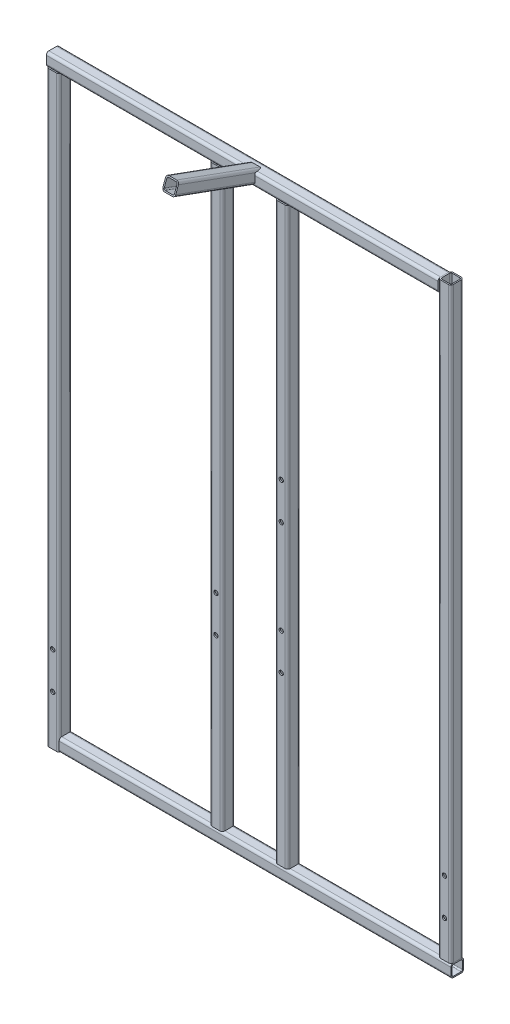
from build123d import *

# Parameters (mm, degrees)
SQUARE_START                          = -467.2
SQUARE_TUBE_20_X_20_X_2_1_DEPTH       = 914.4
SQUARE_START_2                        = -294.8
SQUARE_TUBE_20_X_20_X_2_1_2_DEPTH     = 609.6
SQUARE_START_3                        = -314.8
SQUARE_TUBE_20_X_20_X_2_1_3_DEPTH     = 609.6
SQUARE_START_4                        = -447.2
SQUARE_TUBE_20_X_20_X_2_1_4_DEPTH     = 914.4
SQUARE_TUBE_20_X_20_X_2_1_5_DEPTH     = 894.4
SQUARE_TUBE_20_X_20_X_2_1_6_DEPTH     = 894.4
SQUARE_START_5                        = 158.134879336
SQUARE_TUBE_20_X_20_X_2_1_7_DEPTH     = 137.936730192
SQUARE_START_6                        = 447
SQUARE_TUBE_20_X_20_X_2_1_8_OUTLINE_W = 24
SQUARE_TUBE_20_X_20_X_2_1_8_OUTLINE_H = 13
SQUARE_TUBE_20_X_20_X_2_1_8_DEPTH     = 20.2
SKETCH12_R                            = 3.3782
CUT_EXTRUDE2_DEPTH                    = 616.817984795
SKETCH13_R                            = 3.3782
CUT_EXTRUDE3_DEPTH                    = 616.817984795
SKETCH14_R                            = 3.3782
CUT_EXTRUDE4_DEPTH                    = 616.817984795


with BuildPart() as part:
    # Square tube 20 X 20 X 2(1): read off the stored shape, not the designer's step
    # Square tube 20 X 20 X 2(1) outline → Square tube 20 X 20 X 2(1) (new body)
    with BuildSketch(Plane(origin=(0, 0, 0), x_dir=(1, 0, 0), z_dir=(0, 1, 0)).offset(SQUARE_START)):
        with BuildLine():
            Line((-314.8, 6), (-314.8, -6))
            ThreePointArc((-314.8, -6), (-313.628427125, -8.828427125), (-310.8, -10))
            Line((-310.8, -10), (-298.8, -10))
            ThreePointArc((-298.8, -10), (-295.971572875, -8.828427125), (-294.8, -6))
            Line((-294.8, -6), (-294.8, 6))
            ThreePointArc((-294.8, 6), (-295.971572875, 8.828427125), (-298.8, 10))
            Line((-298.8, 10), (-310.8, 10))
            ThreePointArc((-310.8, 10), (-313.628427125, 8.828427125), (-314.8, 6))
        make_face()
        with BuildLine():
            ThreePointArc((-298.8, 8), (-297.385786438, 7.414213562), (-296.8, 6))
            Line((-296.8, 6), (-296.8, -6))
            ThreePointArc((-296.8, -6), (-297.385786438, -7.414213562), (-298.8, -8))
            Line((-298.8, -8), (-310.8, -8))
            ThreePointArc((-310.8, -8), (-312.214213562, -7.414213562), (-312.8, -6))
            Line((-312.8, -6), (-312.8, 6))
            ThreePointArc((-312.8, 6), (-312.214213562, 7.414213562), (-310.8, 8))
            Line((-310.8, 8), (-298.8, 8))
        make_face(mode=Mode.SUBTRACT)
    extrude(amount=SQUARE_TUBE_20_X_20_X_2_1_DEPTH)

    # Sketch12 → Cut-Extrude2 (cut, through all)
    with BuildSketch(Plane.XY.offset(10)):
        with Locations((-304.8051, -332.58)):
            Circle(SKETCH12_R)
    extrude(amount=-CUT_EXTRUDE2_DEPTH, mode=Mode.SUBTRACT)

    # Sketch13 → Cut-Extrude3 (cut, through all)
    with BuildSketch(Plane.XY.offset(10)):
        with Locations((-304.8051, -389.73)):
            Circle(SKETCH13_R)
    extrude(amount=-CUT_EXTRUDE3_DEPTH, mode=Mode.SUBTRACT)


with BuildPart() as body_2:
    # Square tube 20 X 20 X 2_1 2 outline → Square tube 20 X 20 X 2_1 2 (new body)
    with BuildSketch(Plane.YZ.offset(SQUARE_START_2)):
        with BuildLine():
            Line((-467.2, 6), (-467.2, -6))
            ThreePointArc((-467.2, -6), (-466.028427125, -8.828427125), (-463.2, -10))
            Line((-463.2, -10), (-451.2, -10))
            ThreePointArc((-451.2, -10), (-448.371572875, -8.828427125), (-447.2, -6))
            Line((-447.2, -6), (-447.2, 6))
            ThreePointArc((-447.2, 6), (-448.371572875, 8.828427125), (-451.2, 10))
            Line((-451.2, 10), (-463.2, 10))
            ThreePointArc((-463.2, 10), (-466.028427125, 8.828427125), (-467.2, 6))
        make_face()
        with BuildLine():
            ThreePointArc((-451.2, 8), (-449.785786438, 7.414213562), (-449.2, 6))
            Line((-449.2, 6), (-449.2, -6))
            ThreePointArc((-449.2, -6), (-449.785786438, -7.414213562), (-451.2, -8))
            Line((-451.2, -8), (-463.2, -8))
            ThreePointArc((-463.2, -8), (-464.614213562, -7.414213562), (-465.2, -6))
            Line((-465.2, -6), (-465.2, 6))
            ThreePointArc((-465.2, 6), (-464.614213562, 7.414213562), (-463.2, 8))
            Line((-463.2, 8), (-451.2, 8))
        make_face(mode=Mode.SUBTRACT)
    extrude(amount=SQUARE_TUBE_20_X_20_X_2_1_2_DEPTH)


with BuildPart() as body_3:
    # Square tube 20 X 20 X 2_1 3 outline → Square tube 20 X 20 X 2_1 3 (new body)
    with BuildSketch(Plane.YZ.offset(SQUARE_START_3)):
        with BuildLine():
            Line((467.2, -6), (467.2, 6))
            ThreePointArc((467.2, 6), (466.028427125, 8.828427125), (463.2, 10))
            Line((463.2, 10), (451.2, 10))
            ThreePointArc((451.2, 10), (448.371572875, 8.828427125), (447.2, 6))
            Line((447.2, 6), (447.2, -6))
            ThreePointArc((447.2, -6), (448.371572875, -8.828427125), (451.2, -10))
            Line((451.2, -10), (463.2, -10))
            ThreePointArc((463.2, -10), (466.028427125, -8.828427125), (467.2, -6))
        make_face()
        with BuildLine():
            ThreePointArc((451.2, -8), (449.785786438, -7.414213562), (449.2, -6))
            Line((449.2, -6), (449.2, 6))
            ThreePointArc((449.2, 6), (449.785786438, 7.414213562), (451.2, 8))
            Line((451.2, 8), (463.2, 8))
            ThreePointArc((463.2, 8), (464.614213562, 7.414213562), (465.2, 6))
            Line((465.2, 6), (465.2, -6))
            ThreePointArc((465.2, -6), (464.614213562, -7.414213562), (463.2, -8))
            Line((463.2, -8), (451.2, -8))
        make_face(mode=Mode.SUBTRACT)
    extrude(amount=SQUARE_TUBE_20_X_20_X_2_1_3_DEPTH)


with BuildPart() as body_4:
    # Square tube 20 X 20 X 2_1 4 outline → Square tube 20 X 20 X 2_1 4 (new body)
    with BuildSketch(Plane(origin=(0, 0, 0), x_dir=(1, 0, 0), z_dir=(0, 1, 0)).offset(SQUARE_START_4)):
        with BuildLine():
            Line((314.8, -6), (314.8, 6))
            ThreePointArc((314.8, 6), (313.628427125, 8.828427125), (310.8, 10))
            Line((310.8, 10), (298.8, 10))
            ThreePointArc((298.8, 10), (295.971572875, 8.828427125), (294.8, 6))
            Line((294.8, 6), (294.8, -6))
            ThreePointArc((294.8, -6), (295.971572875, -8.828427125), (298.8, -10))
            Line((298.8, -10), (310.8, -10))
            ThreePointArc((310.8, -10), (313.628427125, -8.828427125), (314.8, -6))
        make_face()
        with BuildLine():
            ThreePointArc((298.8, -8), (297.385786438, -7.414213562), (296.8, -6))
            Line((296.8, -6), (296.8, 6))
            ThreePointArc((296.8, 6), (297.385786438, 7.414213562), (298.8, 8))
            Line((298.8, 8), (310.8, 8))
            ThreePointArc((310.8, 8), (312.214213562, 7.414213562), (312.8, 6))
            Line((312.8, 6), (312.8, -6))
            ThreePointArc((312.8, -6), (312.214213562, -7.414213562), (310.8, -8))
            Line((310.8, -8), (298.8, -8))
        make_face(mode=Mode.SUBTRACT)
    extrude(amount=SQUARE_TUBE_20_X_20_X_2_1_4_DEPTH)


with BuildPart() as body_5:
    # Square tube 20 X 20 X 2_1 5 outline → Square tube 20 X 20 X 2_1 5 (new body)
    with BuildSketch(Plane(origin=(0, 0, 0), x_dir=(1, 0, 0), z_dir=(0, 1, 0)).offset(SQUARE_START_4)):
        with BuildLine():
            Line((44.8, -10), (56.8, -10))
            ThreePointArc((56.8, -10), (59.628427125, -8.828427125), (60.8, -6))
            Line((60.8, -6), (60.8, 6))
            ThreePointArc((60.8, 6), (59.628427125, 8.828427125), (56.8, 10))
            Line((56.8, 10), (44.8, 10))
            ThreePointArc((44.8, 10), (41.971572875, 8.828427125), (40.8, 6))
            Line((40.8, 6), (40.8, -6))
            ThreePointArc((40.8, -6), (41.971572875, -8.828427125), (44.8, -10))
        make_face()
        with BuildLine():
            ThreePointArc((44.8, -8), (43.385786438, -7.414213562), (42.8, -6))
            Line((42.8, -6), (42.8, 6))
            ThreePointArc((42.8, 6), (43.385786438, 7.414213562), (44.8, 8))
            Line((44.8, 8), (56.8, 8))
            ThreePointArc((56.8, 8), (58.214213562, 7.414213562), (58.8, 6))
            Line((58.8, 6), (58.8, -6))
            ThreePointArc((58.8, -6), (58.214213562, -7.414213562), (56.8, -8))
            Line((56.8, -8), (44.8, -8))
        make_face(mode=Mode.SUBTRACT)
    extrude(amount=SQUARE_TUBE_20_X_20_X_2_1_5_DEPTH)


with BuildPart() as body_6:
    # Square tube 20 X 20 X 2_1 6 outline → Square tube 20 X 20 X 2_1 6 (new body)
    with BuildSketch(Plane(origin=(0, 0, 0), x_dir=(1, 0, 0), z_dir=(0, 1, 0)).offset(SQUARE_START_4)):
        with BuildLine():
            Line((-56.8, -10), (-44.8, -10))
            ThreePointArc((-44.8, -10), (-41.971572875, -8.828427125), (-40.8, -6))
            Line((-40.8, -6), (-40.8, 6))
            ThreePointArc((-40.8, 6), (-41.971572875, 8.828427125), (-44.8, 10))
            Line((-44.8, 10), (-56.8, 10))
            ThreePointArc((-56.8, 10), (-59.628427125, 8.828427125), (-60.8, 6))
            Line((-60.8, 6), (-60.8, -6))
            ThreePointArc((-60.8, -6), (-59.628427125, -8.828427125), (-56.8, -10))
        make_face()
        with BuildLine():
            ThreePointArc((-56.8, -8), (-58.214213562, -7.414213562), (-58.8, -6))
            Line((-58.8, -6), (-58.8, 6))
            ThreePointArc((-58.8, 6), (-58.214213562, 7.414213562), (-56.8, 8))
            Line((-56.8, 8), (-44.8, 8))
            ThreePointArc((-44.8, 8), (-43.385786438, 7.414213562), (-42.8, 6))
            Line((-42.8, 6), (-42.8, -6))
            ThreePointArc((-42.8, -6), (-43.385786438, -7.414213562), (-44.8, -8))
            Line((-44.8, -8), (-56.8, -8))
        make_face(mode=Mode.SUBTRACT)
    extrude(amount=SQUARE_TUBE_20_X_20_X_2_1_6_DEPTH)


with BuildPart() as body_7:
    # Square tube 20 X 20 X 2_1 7 outline → Square tube 20 X 20 X 2_1 7 (new body)
    with BuildSketch(Plane(origin=(0, 0, 0), x_dir=(1, 0, 0), z_dir=(0, 0.342020143325673, 0.939692620785907)).offset(SQUARE_START_5)):
        with BuildLine():
            ThreePointArc((6, 419.627466223), (8.828427124, 420.799039099), (10, 423.627466223))
            Line((10, 423.627466223), (10, 435.627466223))
            ThreePointArc((10, 435.627466223), (8.828427125, 438.455893348), (6, 439.627466223))
            Line((6, 439.627466223), (-6, 439.627466223))
            ThreePointArc((-6, 439.627466223), (-8.828427125, 438.455893348), (-10, 435.627466223))
            Line((-10, 435.627466223), (-10, 423.627466223))
            ThreePointArc((-10, 423.627466223), (-8.828427124, 420.799039099), (-6, 419.627466223))
            Line((-6, 419.627466223), (6, 419.627466223))
        make_face()
        with BuildLine():
            Line((-6, 437.627466223), (6, 437.627466223))
            ThreePointArc((6, 437.627466223), (7.414213562, 437.041679785), (8, 435.627466223))
            Line((8, 435.627466223), (8, 423.627466223))
            ThreePointArc((8, 423.627466223), (7.414213562, 422.213252661), (6, 421.627466223))
            Line((6, 421.627466223), (-6, 421.627466223))
            ThreePointArc((-6, 421.627466223), (-7.414213562, 422.213252661), (-8, 423.627466223))
            Line((-8, 423.627466223), (-8, 435.627466223))
            ThreePointArc((-8, 435.627466223), (-7.414213562, 437.041679785), (-6, 437.627466223))
        make_face(mode=Mode.SUBTRACT)
    extrude(amount=SQUARE_TUBE_20_X_20_X_2_1_7_DEPTH)

    # Square tube 20 X 20 X 2_1 8 outline → Square tube 20 X 20 X 2_1 8 (cut)
    with BuildSketch(Plane(origin=(0, 0, 0), x_dir=(1, 0, 0), z_dir=(0, 1, 0)).offset(SQUARE_START_6)):
        with Locations((0, -3.5)):
            Rectangle(SQUARE_TUBE_20_X_20_X_2_1_8_OUTLINE_W, SQUARE_TUBE_20_X_20_X_2_1_8_OUTLINE_H)
    extrude(amount=SQUARE_TUBE_20_X_20_X_2_1_8_DEPTH, mode=Mode.SUBTRACT)


with BuildPart() as cut_extrude4_tool:
    # Sketch14 → Cut-Extrude4 (new, through all)
    with BuildSketch(Plane.XY.offset(10)):
        with Locations((304.7949, -332.58)):
            Circle(SKETCH14_R)
        with Locations((304.7949, -389.73)):
            Circle(SKETCH14_R)
        with Locations((-50.8051, -186.53)):
            Circle(SKETCH14_R)
        with Locations((-50.8051, -129.38)):
            Circle(SKETCH14_R)
        with Locations((50.7949, -129.38)):
            Circle(SKETCH14_R)
        with Locations((50.7949, -186.53)):
            Circle(SKETCH14_R)
        with Locations((50.7949, 73.82)):
            Circle(SKETCH14_R)
        with Locations((50.7949, 16.67)):
            Circle(SKETCH14_R)
    extrude(amount=-CUT_EXTRUDE4_DEPTH)


with BuildPart() as body_4_1:
    add(body_4.part)

    # Cut-Extrude4: cut by cut_extrude4_tool
    add(cut_extrude4_tool.part, mode=Mode.SUBTRACT)


with BuildPart() as body_5_1:
    add(body_5.part)

    # Cut-Extrude4: cut by cut_extrude4_tool
    add(cut_extrude4_tool.part, mode=Mode.SUBTRACT)


with BuildPart() as body_6_1:
    add(body_6.part)

    # Cut-Extrude4: cut by cut_extrude4_tool
    add(cut_extrude4_tool.part, mode=Mode.SUBTRACT)


solid = Compound([part.part, body_2.part, body_3.part, body_7.part, body_4_1.part, body_5_1.part, body_6_1.part])
